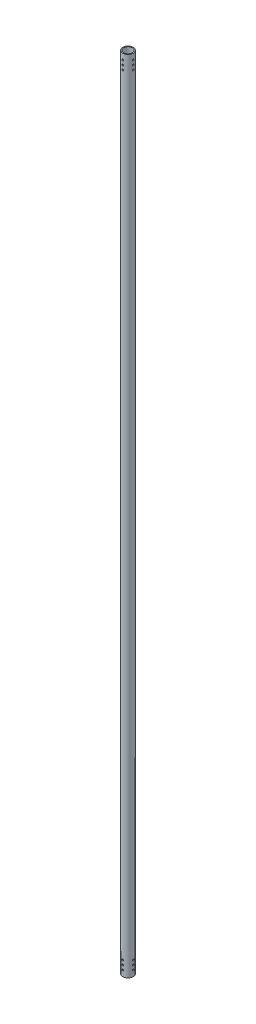
from build123d import *

# Parameters (mm, degrees)
EXTRUDE_1_OUTLINE_R                = 18
EXTRUDE_1_OUTLINE_R_2              = 15
EXTRUDE_1_DEPTH                    = 2780
SKETCH_2_R                         = 3
CUT_EXTRUDE_1_DEPTH                = 2781.11654432
PATTERN_LINEAR_1_COUNT             = 3
PATTERN_LINEAR_1_PITCH             = 15
PATTERN_CIRCULAR_1_COUNT           = 2
PATTERN_CIRCULAR_1_ANGLE           = 90
PATTERN_CIRCULAR_1_COPY_1_SKETCH_R = 3
PATTERN_CIRCULAR_1_COPY_1_DEPTH    = 2781.11654432
PATTERN_CIRCULAR_1_COPY_2_SKETCH_R = 3
PATTERN_CIRCULAR_1_COPY_2_DEPTH    = 2781.11654432


# Read off the part's stored shape, not the designer's step: Вытянуть-Тонкостенный1
with BuildPart() as part:
    # Вытянуть-Тонкостенный1 outline → Вытянуть-Тонкостенный1 (new body)
    with BuildSketch(Plane(origin=(0, 0, 0), x_dir=(1, 0, 0), z_dir=(0, 1, 0))):
        Circle(EXTRUDE_1_OUTLINE_R)
        Circle(EXTRUDE_1_OUTLINE_R_2, mode=Mode.SUBTRACT)
    extrude(amount=EXTRUDE_1_DEPTH)

    # Эскиз2 → Вырез-Вытянуть1 (cut, symmetric)
    with BuildSketch(Plane.XY):
        with Locations((0, 2730)):
            Circle(SKETCH_2_R)
        with Locations((0, 44)):
            Circle(SKETCH_2_R)
    cut_extrude_1 = extrude(amount=CUT_EXTRUDE_1_DEPTH, both=True, mode=Mode.SUBTRACT)

    # Линейный массив1: Вырез-Вытянуть1 ×3
    with Locations(*[(0, i * PATTERN_LINEAR_1_PITCH, 0) for i in range(1, PATTERN_LINEAR_1_COUNT)]):
        add(cut_extrude_1, mode=Mode.SUBTRACT)

    # Круговой массив1: Вырез-Вытянуть1 ×2 about axis
    pattern_circular_1_axis = Axis((0, 2780, 0), (0, -1, 0))
    for i in range(1, PATTERN_CIRCULAR_1_COUNT):
        add(cut_extrude_1.rotate(pattern_circular_1_axis, i * PATTERN_CIRCULAR_1_ANGLE / (PATTERN_CIRCULAR_1_COUNT - 1)), mode=Mode.SUBTRACT)

    # Круговой массив1 copy 1 sketch → Круговой массив1 copy 1 (cut, symmetric)
    with BuildSketch(Plane(origin=(0, 15, 0), x_dir=(0, 0, 1), z_dir=(-1, 0, 0))):
        with Locations((0, 2730)):
            Circle(PATTERN_CIRCULAR_1_COPY_1_SKETCH_R)
        with Locations((0, 44)):
            Circle(PATTERN_CIRCULAR_1_COPY_1_SKETCH_R)
    extrude(amount=PATTERN_CIRCULAR_1_COPY_1_DEPTH, both=True, mode=Mode.SUBTRACT)

    # Круговой массив1 copy 2 sketch → Круговой массив1 copy 2 (cut, symmetric)
    with BuildSketch(Plane(origin=(0, 30, 0), x_dir=(0, 0, 1), z_dir=(-1, 0, 0))):
        with Locations((0, 2730)):
            Circle(PATTERN_CIRCULAR_1_COPY_2_SKETCH_R)
        with Locations((0, 44)):
            Circle(PATTERN_CIRCULAR_1_COPY_2_SKETCH_R)
    extrude(amount=PATTERN_CIRCULAR_1_COPY_2_DEPTH, both=True, mode=Mode.SUBTRACT)

    # Surface Cut 1
    split(bisect_by=Plane(origin=(0, 24, 0), x_dir=(1, 0, 0), z_dir=(0, 1, 0)), keep=Keep.TOP)


solid = part.part
